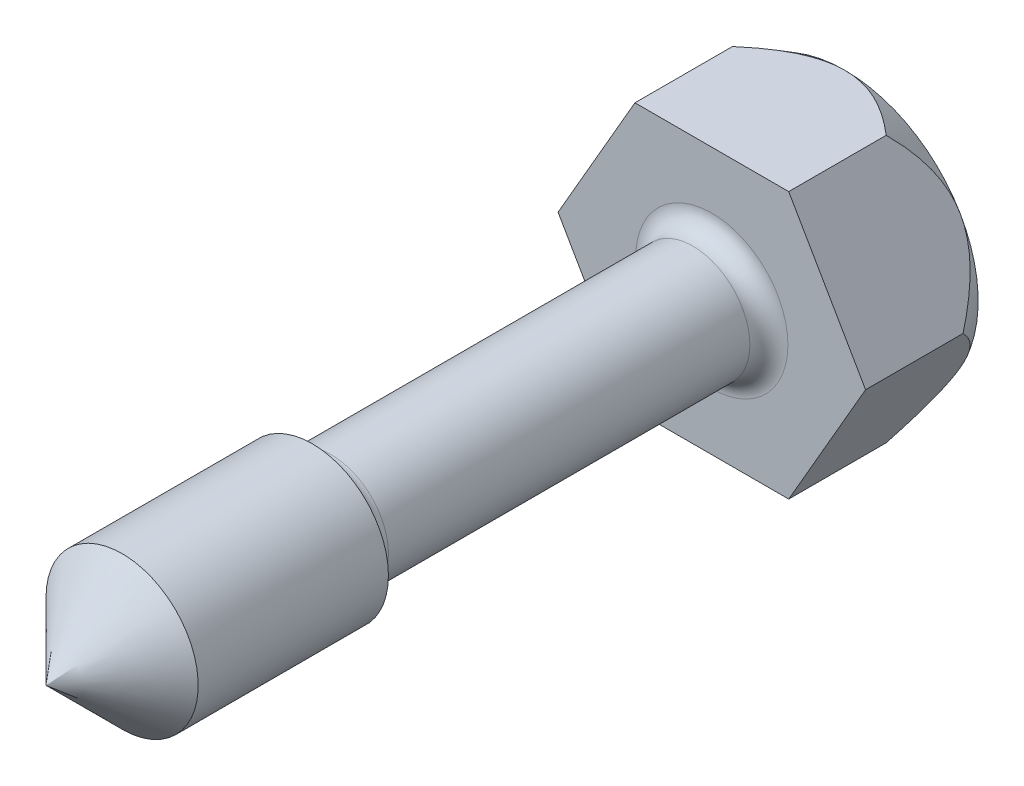
from build123d import *

# Parameters (mm, degrees)
BOSS_EXTRUDE1_DEPTH = 7
SKETCH2_W           = 4
SKETCH2_H           = 35
SKETCH3_W           = 1
SKETCH3_H           = 21
FILLET1_R           = 1
SKETCH6_OUTSIDE_W   = 78.792
SKETCH6_OUTSIDE_H   = 76.626
SKETCH6_OUTSIDE_R   = 7
CUT_EXTRUDE1_DEPTH  = 44.339743116
CUT_EXTRUDE1_DRAFT  = -30


with BuildPart() as part:
    # Sketch1 → Boss-Extrude1 (new body)
    with BuildSketch(Plane.XY):
        Polygon((4.041451884, 7), (-4.041451884, 7), (-8.082903769, 0), (-4.041451884, -7), (4.041451884, -7), (8.082903769, 0), align=None)
    extrude(amount=BOSS_EXTRUDE1_DEPTH)

    # Sketch2 → Revolve1 (revolve)
    with BuildSketch(Plane(origin=(0, 0, 0), x_dir=(1, 0, 0), z_dir=(0, 1, 0))):
        with Locations((-2, -24.5)):
            Rectangle(SKETCH2_W, SKETCH2_H)
    revolve(axis=Axis((0, 0, -34.920005339), (0, 0, 1)))

    # Sketch3 → Cut-Revolve1 (revolve, cut)
    with BuildSketch(Plane(origin=(0, 0, 0), x_dir=(1, 0, 0), z_dir=(0, 1, 0))):
        with Locations((-3.5, -17.5)):
            Rectangle(SKETCH3_W, SKETCH3_H)
    revolve(axis=Axis((0, 0, -11.162931032), (0, 0, 1)), mode=Mode.SUBTRACT)

    # Sketch5 → Cut-Revolve11 (revolve, cut)
    with BuildSketch(Plane(origin=(0, 0, 0), x_dir=(1, 0, 0), z_dir=(0, 1, 0))):
        Polygon((-5e-05, -42), (-4, -38.00005), (-4, -42), align=None)
    revolve(axis=Axis((0, 0, -15.823423108), (0, 0, 1)), mode=Mode.SUBTRACT)

    # Fillet1
    fillet1_edges = [part.edges().sort_by_distance(p)[0] for p in [
        (3, 0, 28),
        (3, 0, 7),
    ]]
    fillet(fillet1_edges, radius=FILLET1_R - 0.0001)  # a hair under: the kernel refuses the full size


with BuildPart() as cut_extrude1_tool:
    # Sketch6 outside → Cut-Extrude1 (with draft: the straight prism first)
    with BuildSketch(Plane(origin=(0, 0, 0), x_dir=(-1, 0, 0), z_dir=(0, 0, -1))):
        Rectangle(SKETCH6_OUTSIDE_W, SKETCH6_OUTSIDE_H)
        Circle(SKETCH6_OUTSIDE_R, mode=Mode.SUBTRACT)
    extrude(amount=-CUT_EXTRUDE1_DEPTH)
    # Cut-Extrude1: the draft: its side faces are tilted about the plane it starts from
    cut_extrude1_sides = [cut_extrude1_tool.faces().sort_by_distance(p)[0] for p in [
        (0, -38.313, 22.169871558),
        (-39.396, 0, 22.169871558),
        (0, 38.313, 22.169871558),
        (39.396, 0, 22.169871558),
        (7, 0, 22.169871558),
    ]]
    draft(cut_extrude1_sides, Plane(origin=(0, 0, 0), x_dir=(-1, 0, 0), z_dir=(0, 0, -1)), CUT_EXTRUDE1_DRAFT)


with BuildPart() as part_1:
    add(part.part)

    # Cut-Extrude1: cut by cut_extrude1_tool
    add(cut_extrude1_tool.part, mode=Mode.SUBTRACT)


solid = part_1.part
